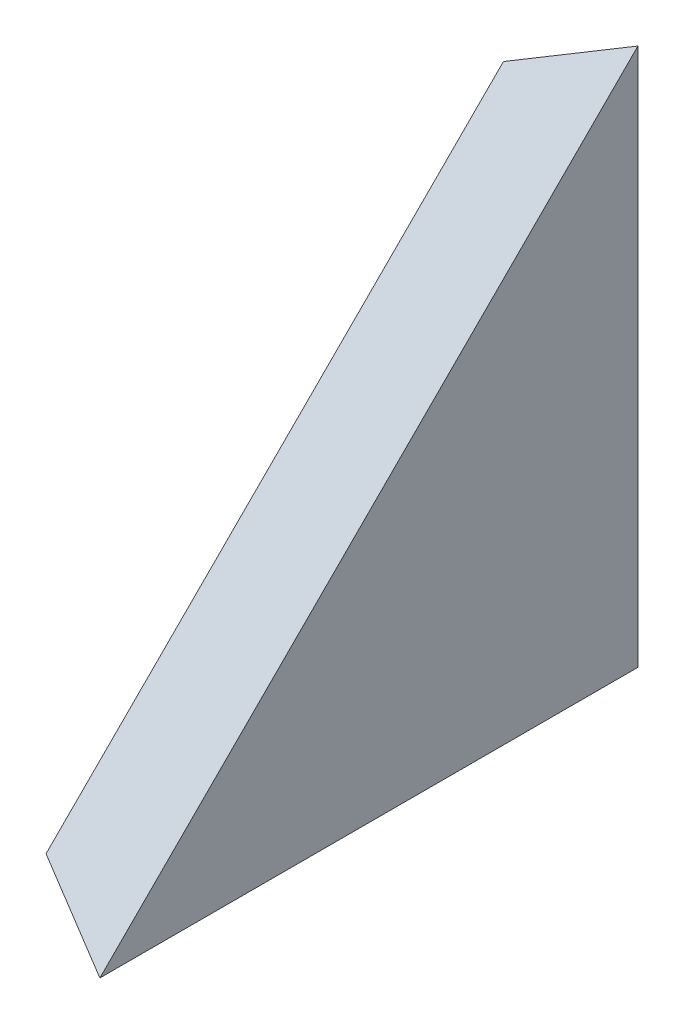
from build123d import *

# Parameters (mm, degrees)
BOSS_EXTRUDE1_DEPTH    = 12.7
CUT_EXTRUDE1_START     = -16.533991695
CUT_EXTRUDE1_OUTLINE_W = 17
CUT_EXTRUDE1_OUTLINE_H = 74
CUT_EXTRUDE1_DEPTH     = 4.960197509


# Read off the part's stored shape, not the designer's step: Cut-Extrude1
with BuildPart() as part:
    # Sketch1 → Boss-Extrude1 (new body)
    with BuildSketch(Plane(origin=(0, 0, 0), x_dir=(0, 0, -1), z_dir=(1, 0, 0))):
        Polygon((-25.4, 0), (25.4, 0), (25.4, 50.8), align=None)
    extrude(amount=BOSS_EXTRUDE1_DEPTH)

    # Cut-Extrude1 outline → Cut-Extrude1 (cut)
    with BuildSketch(Plane(origin=(0, 0, 0), x_dir=(0.9205746178983232, 0.2761723853694974, 0.27617238536949734), z_dir=(0.39056673294247213, -0.6509445549041193, -0.6509445549041192)).offset(CUT_EXTRUDE1_START)):
        with Locations((11.5, -18)):
            Rectangle(CUT_EXTRUDE1_OUTLINE_W, CUT_EXTRUDE1_OUTLINE_H)
    extrude(amount=CUT_EXTRUDE1_DEPTH, mode=Mode.SUBTRACT)


solid = part.part
